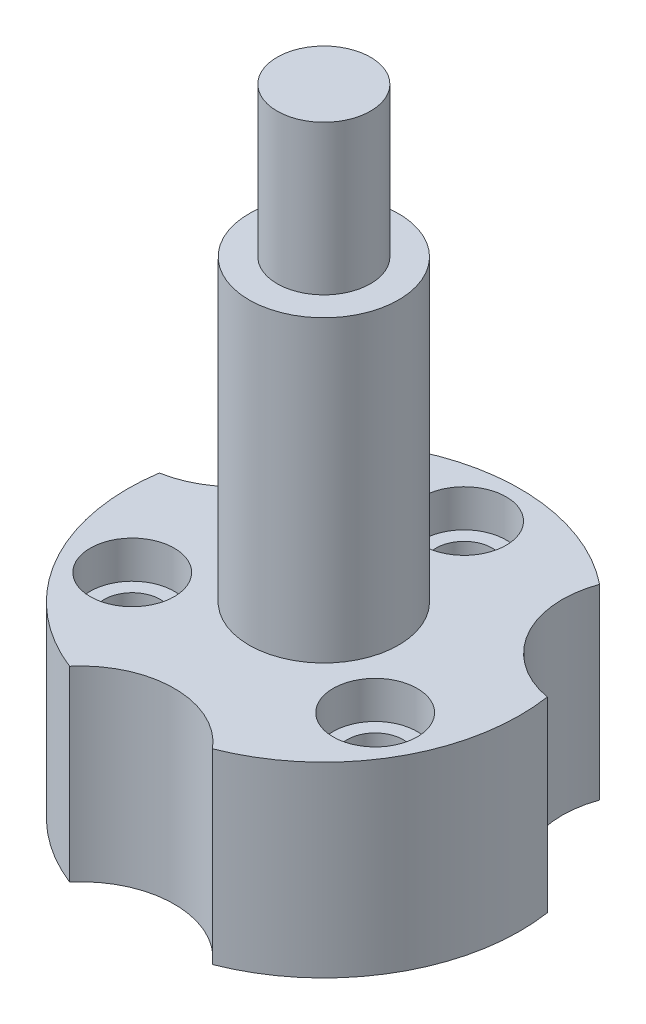
from build123d import *
from build123d.topology import SkipClean

# Parameters (mm, degrees)
SKETCH1_R               = 10.5
SKETCH1_R_2             = 4
BOSS_EXTRUDE1_DEPTH     = 10
SKETCH1_3_R             = 4
BOSS_EXTRUDE2_DEPTH     = 17
CUT_EXTRUDE3_DEPTH      = 38.101212918
CUT_EXTRUDE3_DEPTH_BACK = 38.101212918
SKETCH4_R               = 5
HOLE1_D                 = 3
HOLE1_DEPTH             = 10
HOLE1_CBORE_D           = 4.5
HOLE1_CBORE_DEPTH       = 2
HOLE1_TIP               = 0.901290929
HOLE2_D                 = 11
HOLE2_DEPTH             = 7
SKETCH10_R              = 8.667878953
SKETCH10_R_2            = 2.5
CUT_EXTRUDE4_DEPTH      = 8


# Read off the part's stored shape, not the designer's step: M8x1.25 Machine Threads Stud1
with BuildPart() as part:
    # Sketch1 → Boss-Extrude1 (new body)
    # profile 1 of 2: a face of its own
    with BuildSketch(Plane(origin=(0, 0, 0), x_dir=(1, 0, 0), z_dir=(0, 1, 0))):
        with Locations(Location((0, 0, 0), (0, 0, 270))):
            Circle(SKETCH1_R)
        Circle(SKETCH1_R_2, mode=Mode.SUBTRACT)
    # profile 2 of 2: a face of its own
    with BuildSketch(Plane(origin=(0, 0, 0), x_dir=(1, 0, 0), z_dir=(0, 1, 0))):
        Circle(SKETCH1_R_2)
    extrude(amount=BOSS_EXTRUDE1_DEPTH)

    # Sketch1<3> → Boss-Extrude2 (add)
    with BuildSketch(Plane(origin=(0, 0, 0), x_dir=(1, 0, 0), z_dir=(0, 1, 0))):
        with Locations(Location((0, 0, 0), (0, 0, 270))):
            Circle(SKETCH1_3_R)
    extrude(amount=BOSS_EXTRUDE2_DEPTH)

    # M8x1.25 Machine Threads Stud1 outline → M8x1.25 Machine Threads Stud1 (revolve)
    with SkipClean():  # the faces are left unmerged after this step: merging them gives an invalid solid
        with BuildSketch(Plane.XY):
            Polygon((4, 17), (4, 33.3095), (3.3095, 34), (0, 34), (0, 17), align=None)
        revolve(axis=Axis((0, 0, 0), (0, 1, 0)))

    # Sketch4 → Cut-Extrude3 (cut, two sides: drawn at the far end of the back side and taken through both)
    with SkipClean():  # the faces are left unmerged after this step: merging them gives an invalid solid
        with BuildSketch(Plane(origin=(0, 0, 0), x_dir=(1, 0, 0), z_dir=(0, 1, 0)).offset(-CUT_EXTRUDE3_DEPTH_BACK)):
            with Locations((0, -13)):
                Circle(SKETCH4_R)
            with Locations((-11.258330249, 6.5)):
                Circle(SKETCH4_R)
            with Locations((11.258330249, 6.5)):
                Circle(SKETCH4_R)
        extrude(amount=CUT_EXTRUDE3_DEPTH + CUT_EXTRUDE3_DEPTH_BACK, mode=Mode.SUBTRACT)

    # Hole1
    with Locations(Plane(origin=(0, 10, 0), x_dir=(1, 0, 0), z_dir=(0, 1, 0))):
        with Locations((0, 7.505553499), (6.5, -3.75277675), (-6.5, -3.75277675)):
            CounterBoreHole(HOLE1_D / 2, HOLE1_CBORE_D / 2, HOLE1_CBORE_DEPTH, depth=HOLE1_DEPTH)
            with Locations((0, 0, -(HOLE1_DEPTH + HOLE1_TIP / 2))):  # 118° drill point
                Cone(0, HOLE1_D / 2, HOLE1_TIP, mode=Mode.SUBTRACT)

    # Hole2
    with Locations(Plane(origin=(0, 0, 0), x_dir=(-1, 0, 0), z_dir=(0, -1, 0))):
        with Locations((0, 0)):
            Hole(HOLE2_D / 2, depth=HOLE2_DEPTH)

    # Sketch10 → Cut-Extrude4 (cut)
    with SkipClean():  # the faces are left unmerged after this step: merging them gives an invalid solid
        with BuildSketch(Plane(origin=(0, 34, 0), x_dir=(1, 0, 0), z_dir=(0, 1, 0))):
            Circle(SKETCH10_R)
            with Locations(Location((0, 0, 0), (0, 0, 270))):
                Circle(SKETCH10_R_2, mode=Mode.SUBTRACT)
        extrude(amount=-CUT_EXTRUDE4_DEPTH, mode=Mode.SUBTRACT)
    add(part.part.scale(1), mode=Mode.REPLACE)  # the faces are merged on a copy


solid = part.part
